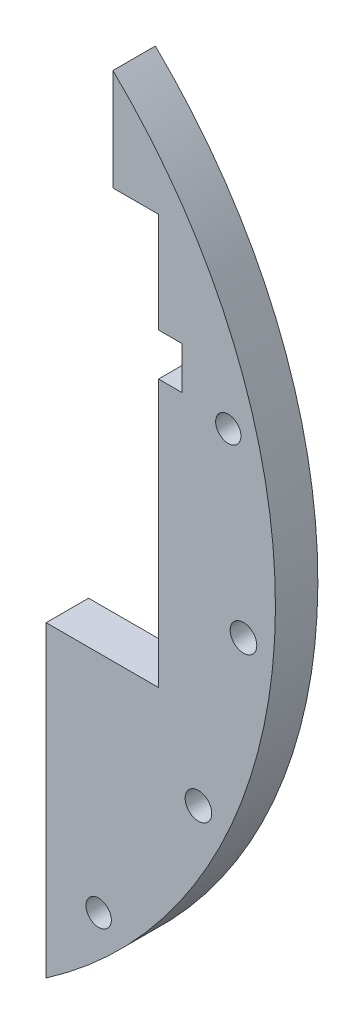
from build123d import *

# Parameters (mm, degrees)
SKETCH1_R              = 79.5
SKETCH1_R_2            = 1.9939
SKETCH1_R_3            = 1.89865
SKETCH1_R_4            = 8
BOSS_EXTRUDE1_DEPTH    = 6.35
SKETCH5_W              = 15.2
SKETCH5_H              = 16.075
CUT_EXTRUDE4_DEPTH     = 113.609158153
SKETCH6_R              = 1
CUT_EXTRUDE5_DEPTH     = 113.609158153
FILLET1_R              = 1
SKETCH10_W             = 53.523609979
SKETCH10_H             = 37.243469735
SKETCH10_W_2           = 54.285324016
SKETCH10_H_2           = 37.23416744
BOSS_EXTRUDE2_DEPTH    = 6.35
SKETCH11_W             = 15.2
SKETCH11_H             = 6.55
CUT_EXTRUDE8_DEPTH     = 113.609158153
SKETCH13_R             = 1
CUT_EXTRUDE9_DEPTH     = 113.609158153
FILLET2_R              = 1
LPATTERN3_COUNT        = 2
LPATTERN3_PITCH        = 30
FILLET2_OF_LPATTERN3_R = 1
MIRROR3_DEPTH          = 6.35
CUT_EXTRUDE11_DEPTH    = 113.609158153
SKETCH15_W             = 6.35
SKETCH15_H             = 80
CUT_EXTRUDE12_DEPTH    = 113.609158153
CUT_EXTRUDE14_DEPTH    = 113.609158153
CUT_EXTRUDE18_DEPTH    = 104.150578646


# Read off the part's stored shape, not the designer's step: Mirror3
with BuildPart() as part:
    # Sketch1 → Boss-Extrude1 (new body)
    with BuildSketch(Plane.XY):
        Circle(SKETCH1_R)
        with Locations((74.714602357, -6.536680706)):
            Circle(SKETCH1_R_2, mode=Mode.SUBTRACT)
        with Locations((72.444436972, 19.411428383)):
            Circle(SKETCH1_R_3, mode=Mode.SUBTRACT)
        Circle(SKETCH1_R_4, mode=Mode.SUBTRACT)
        with Locations((67.973084028, -31.696369631)):
            Circle(SKETCH1_R_2, mode=Mode.SUBTRACT)
        with Locations((10.606601718, -10.606601718)):
            Circle(SKETCH1_R_2, mode=Mode.SUBTRACT)
        with Locations((0, -75)):
            Circle(SKETCH1_R_3, mode=Mode.SUBTRACT)
        with Locations((-10.606601718, -10.606601718)):
            Circle(SKETCH1_R_2, mode=Mode.SUBTRACT)
        with Locations((-10.606601718, 10.606601718)):
            Circle(SKETCH1_R_2, mode=Mode.SUBTRACT)
        with Locations((10.606601718, 10.606601718)):
            Circle(SKETCH1_R_2, mode=Mode.SUBTRACT)
        with Locations((-53.033008589, -53.033008589)):
            Circle(SKETCH1_R_3, mode=Mode.SUBTRACT)
        with Locations((-75, 0)):
            Circle(SKETCH1_R_3, mode=Mode.SUBTRACT)
        with Locations((-53.033008589, 53.033008589)):
            Circle(SKETCH1_R_3, mode=Mode.SUBTRACT)
        with Locations((0, 75)):
            Circle(SKETCH1_R_3, mode=Mode.SUBTRACT)
        with Locations((53.033008589, -53.033008589)):
            Circle(SKETCH1_R_3, mode=Mode.SUBTRACT)
    extrude(amount=BOSS_EXTRUDE1_DEPTH)

    # Sketch5 → Cut-Extrude4 (cut, through all)
    with BuildSketch(Plane.XY.offset(6.35)):
        with Locations((-30, -37.9375)):
            Rectangle(SKETCH5_W, SKETCH5_H)
        with Locations((-30, 37.9375)):
            Rectangle(SKETCH5_W, SKETCH5_H)
        with Locations((30, 37.9375)):
            Rectangle(SKETCH5_W, SKETCH5_H)
        with Locations((0, -37.9375)):
            Rectangle(SKETCH5_W, SKETCH5_H)
        with Locations((30, -37.9375)):
            Rectangle(SKETCH5_W, SKETCH5_H)
        with Locations((0, 37.9375)):
            Rectangle(SKETCH5_W, SKETCH5_H)
    extrude(amount=-CUT_EXTRUDE4_DEPTH, mode=Mode.SUBTRACT)

    # Sketch6 → Cut-Extrude5 (cut, through all)
    with BuildSketch(Plane.XY.offset(6.35)):
        with Locations((-37.6, 45.975)):
            Circle(SKETCH6_R)
        with Locations((-22.4, 45.975)):
            Circle(SKETCH6_R)
        with Locations((-37.6, 29.9)):
            Circle(SKETCH6_R)
        with Locations((-22.4, 29.9)):
            Circle(SKETCH6_R)
        with Locations((-7.6, 45.975)):
            Circle(SKETCH6_R)
        with Locations((7.6, 45.975)):
            Circle(SKETCH6_R)
        with Locations((-7.6, 29.9)):
            Circle(SKETCH6_R)
        with Locations((7.6, 29.9)):
            Circle(SKETCH6_R)
        with Locations((22.4, 45.975)):
            Circle(SKETCH6_R)
        with Locations((37.6, 45.975)):
            Circle(SKETCH6_R)
        with Locations((22.4, 29.9)):
            Circle(SKETCH6_R)
        with Locations((37.6, 29.9)):
            Circle(SKETCH6_R)
        with Locations((-37.6, -29.9)):
            Circle(SKETCH6_R)
        with Locations((-22.4, -29.9)):
            Circle(SKETCH6_R)
        with Locations((-37.6, -45.975)):
            Circle(SKETCH6_R)
        with Locations((-22.4, -45.975)):
            Circle(SKETCH6_R)
        with Locations((-7.6, -29.9)):
            Circle(SKETCH6_R)
        with Locations((7.6, -29.9)):
            Circle(SKETCH6_R)
        with Locations((-7.6, -45.975)):
            Circle(SKETCH6_R)
        with Locations((7.6, -45.975)):
            Circle(SKETCH6_R)
        with Locations((22.4, -29.9)):
            Circle(SKETCH6_R)
        with Locations((37.6, -29.9)):
            Circle(SKETCH6_R)
        with Locations((22.4, -45.975)):
            Circle(SKETCH6_R)
        with Locations((37.6, -45.975)):
            Circle(SKETCH6_R)
    extrude(amount=-CUT_EXTRUDE5_DEPTH, mode=Mode.SUBTRACT)

    # Fillet1
    fillet1_edges = [part.edges().sort_by_distance(p)[0] for p in [
        (-37.6, 44.975, 3.175),
        (-36.6, 45.975, 3.175),
        (-22.4, 44.975, 3.175),
        (-23.4, 45.975, 3.175),
        (-37.6, 30.9, 3.175),
        (-36.6, 29.9, 3.175),
        (-23.4, 29.9, 3.175),
        (-22.4, 30.9, 3.175),
        (-7.6, 44.975, 3.175),
        (-6.6, 45.975, 3.175),
        (7.6, 44.975, 3.175),
        (6.6, 45.975, 3.175),
        (-7.6, 30.9, 3.175),
        (-6.6, 29.9, 3.175),
        (6.6, 29.9, 3.175),
        (7.6, 30.9, 3.175),
        (22.4, 44.975, 3.175),
        (23.4, 45.975, 3.175),
        (37.6, 44.975, 3.175),
        (36.6, 45.975, 3.175),
        (22.4, 30.9, 3.175),
        (23.4, 29.9, 3.175),
        (36.6, 29.9, 3.175),
        (37.6, 30.9, 3.175),
        (-36.6, -29.9, 3.175),
        (-37.6, -30.9, 3.175),
        (-22.4, -30.9, 3.175),
        (-23.4, -29.9, 3.175),
        (-36.6, -45.975, 3.175),
        (-37.6, -44.975, 3.175),
        (-23.4, -45.975, 3.175),
        (-22.4, -44.975, 3.175),
        (-6.6, -29.9, 3.175),
        (-7.6, -30.9, 3.175),
        (7.6, -30.9, 3.175),
        (6.6, -29.9, 3.175),
        (-6.6, -45.975, 3.175),
        (-7.6, -44.975, 3.175),
        (6.6, -45.975, 3.175),
        (7.6, -44.975, 3.175),
        (23.4, -29.9, 3.175),
        (22.4, -30.9, 3.175),
        (37.6, -30.9, 3.175),
        (36.6, -29.9, 3.175),
        (23.4, -45.975, 3.175),
        (22.4, -44.975, 3.175),
        (36.6, -45.975, 3.175),
        (37.6, -44.975, 3.175),
    ]]
    fillet(fillet1_edges, radius=FILLET1_R)

    # Sketch10 → Boss-Extrude2 (add, through all)
    with BuildSketch(Plane(origin=(0, 0, 0), x_dir=(-1, 0, 0), z_dir=(0, 0, -1))):
        with Locations((-13.786008458, 43.712822415)):
            Rectangle(SKETCH10_W, SKETCH10_H)
        with Locations((-15.177733449, -42.065637654)):
            Rectangle(SKETCH10_W_2, SKETCH10_H_2)
    extrude(amount=-BOSS_EXTRUDE2_DEPTH)

    # Sketch11 → Cut-Extrude8 (cut, through all)
    with BuildSketch(Plane(origin=(0, 0, 0), x_dir=(-1, 0, 0), z_dir=(0, 0, -1))):
        with Locations((0, 33.175)):
            Rectangle(SKETCH11_W, SKETCH11_H)
    cut_extrude8 = extrude(amount=-CUT_EXTRUDE8_DEPTH, mode=Mode.SUBTRACT)

    # Sketch13 → Cut-Extrude9 (cut, through all)
    with BuildSketch(Plane(origin=(0, 0, 0), x_dir=(-1, 0, 0), z_dir=(0, 0, -1))):
        with Locations((-7.6, 36.45)):
            Circle(SKETCH13_R)
        with Locations((-7.6, 29.9)):
            Circle(SKETCH13_R)
        with Locations((7.6, 29.9)):
            Circle(SKETCH13_R)
        with Locations((7.6, 36.45)):
            Circle(SKETCH13_R)
    cut_extrude9 = extrude(amount=-CUT_EXTRUDE9_DEPTH, mode=Mode.SUBTRACT)

    # Fillet2
    fillet2_edges = [part.edges().sort_by_distance(p)[0] for p in [
        (6.6, 36.45, 3.175),
        (7.6, 35.45, 3.175),
        (-6.6, 36.45, 3.175),
        (7.6, 30.9, 3.175),
        (-6.6, 29.9, 3.175),
        (6.6, 29.9, 3.175),
        (-7.6, 30.9, 3.175),
        (-7.6, 35.45, 3.175),
    ]]
    fillet(fillet2_edges, radius=FILLET2_R)

    # LPattern3: Cut-Extrude8, Cut-Extrude9 ×2
    with Locations(*[(i * LPATTERN3_PITCH, 0, 0) for i in range(1, LPATTERN3_COUNT)]):
        add(cut_extrude8, mode=Mode.SUBTRACT)
        add(cut_extrude9, mode=Mode.SUBTRACT)

    # Fillet2 of LPattern3
    fillet2_of_lpattern3_edges = [part.edges().sort_by_distance(p)[0] for p in [
        (36.6, 36.45, 3.175),
        (37.6, 35.45, 3.175),
        (23.4, 36.45, 3.175),
        (37.6, 30.9, 3.175),
        (23.4, 29.9, 3.175),
        (36.6, 29.9, 3.175),
        (22.4, 30.9, 3.175),
        (22.4, 35.45, 3.175),
    ]]
    fillet(fillet2_of_lpattern3_edges, radius=FILLET2_OF_LPATTERN3_R)

    # Mirror3 outline → Mirror3 (cut)
    with BuildSketch(Plane.XY):
        with BuildLine():
            Line((-5.867949192, -36.45), (5.867949192, -36.45))
            ThreePointArc((5.867949192, -36.45), (6.367949192, -36.583974596), (6.733974596, -36.95))
            ThreePointArc((6.733974596, -36.95), (8.307106781, -37.157106781), (8.1, -35.583974596))
            ThreePointArc((8.1, -35.583974596), (7.733974596, -35.217949192), (7.6, -34.717949192))
            Line((7.6, -34.717949192), (7.6, -31.632050808))
            ThreePointArc((7.6, -31.632050808), (7.733974596, -31.132050808), (8.1, -30.766025404))
            ThreePointArc((8.1, -30.766025404), (8.307106781, -29.192893219), (6.733974596, -29.4))
            ThreePointArc((6.733974596, -29.4), (6.367949192, -29.766025404), (5.867949192, -29.9))
            Line((5.867949192, -29.9), (-5.867949192, -29.9))
            ThreePointArc((-5.867949192, -29.9), (-6.367949192, -29.766025404), (-6.733974596, -29.4))
            ThreePointArc((-6.733974596, -29.4), (-8.307106781, -29.192893219), (-8.1, -30.766025404))
            ThreePointArc((-8.1, -30.766025404), (-7.733974596, -31.132050808), (-7.6, -31.632050808))
            Line((-7.6, -31.632050808), (-7.6, -34.717949192))
            ThreePointArc((-7.6, -34.717949192), (-7.733974596, -35.217949192), (-8.1, -35.583974596))
            ThreePointArc((-8.1, -35.583974596), (-8.307106781, -37.157106781), (-6.733974596, -36.95))
            ThreePointArc((-6.733974596, -36.95), (-6.367949192, -36.583974596), (-5.867949192, -36.45))
        make_face()
        with BuildLine():
            Line((24.132050808, -36.45), (35.867949192, -36.45))
            ThreePointArc((35.867949192, -36.45), (36.367949192, -36.583974596), (36.733974596, -36.95))
            ThreePointArc((36.733974596, -36.95), (38.307106781, -37.157106781), (38.1, -35.583974596))
            ThreePointArc((38.1, -35.583974596), (37.733974596, -35.217949192), (37.6, -34.717949192))
            Line((37.6, -34.717949192), (37.6, -31.632050808))
            ThreePointArc((37.6, -31.632050808), (37.733974596, -31.132050808), (38.1, -30.766025404))
            ThreePointArc((38.1, -30.766025404), (38.307106781, -29.192893219), (36.733974596, -29.4))
            ThreePointArc((36.733974596, -29.4), (36.367949192, -29.766025404), (35.867949192, -29.9))
            Line((35.867949192, -29.9), (24.132050808, -29.9))
            ThreePointArc((24.132050808, -29.9), (23.632050808, -29.766025404), (23.266025404, -29.4))
            ThreePointArc((23.266025404, -29.4), (21.692893219, -29.192893219), (21.9, -30.766025404))
            ThreePointArc((21.9, -30.766025404), (22.266025404, -31.132050808), (22.4, -31.632050808))
            Line((22.4, -31.632050808), (22.4, -34.717949192))
            ThreePointArc((22.4, -34.717949192), (22.266025404, -35.217949192), (21.9, -35.583974596))
            ThreePointArc((21.9, -35.583974596), (21.692893219, -37.157106781), (23.266025404, -36.95))
            ThreePointArc((23.266025404, -36.95), (23.632050808, -36.583974596), (24.132050808, -36.45))
        make_face()
    extrude(amount=MIRROR3_DEPTH, mode=Mode.SUBTRACT)

    # Sketch14 → Cut-Extrude11 (cut, through all)
    with BuildSketch(Plane.XY):
        Polygon((33.5, -19.35), (62, -19.35), (62, 20.65), (65.5, 20.65), (65.5, 27), (62, 27), (62, 42), (42, 42), (42, 27), (38.5, 27), (38.5, 20.65), (42, 20.65), (42, 15.65), (33.5, 15.65), align=None)
    extrude(amount=CUT_EXTRUDE11_DEPTH, mode=Mode.SUBTRACT)

    # Sketch15 → Cut-Extrude12 (cut, through all)
    with BuildSketch(Plane.XY.offset(6.35)):
        with Locations((52, 42)):
            Rectangle(SKETCH15_W, SKETCH15_H)
    extrude(amount=-CUT_EXTRUDE12_DEPTH, mode=Mode.SUBTRACT)

    # Sketch16 → Cut-Extrude14 (cut, through all)
    with BuildSketch(Plane.XY):
        with BuildLine():
            Line((42, -37.5), (42, -14.02059918))
            Line((42, -14.02059918), (45.175, -14.029540215))
            Line((45.175, -14.029540215), (45.175, -79.5))
            Line((45.175, -79.5), (0, -79.5))
            ThreePointArc((0, -79.5), (29.69848481, -67.19848481), (42, -37.5))
        make_face()
        with BuildLine():
            Line((0, 79.5), (45.175, 79.5))
            Line((45.175, 79.5), (45.175, 14.029540215))
            Line((45.175, 14.029540215), (42, 14.02059918))
            Line((42, 14.02059918), (42, 37.5))
            ThreePointArc((42, 37.5), (29.69848481, 67.19848481), (0, 79.5))
        make_face()
    extrude(amount=CUT_EXTRUDE14_DEPTH, mode=Mode.SUBTRACT)


with BuildPart() as cut_extrude14_piece_1:
    # of the separate pieces the step leaves, piece 1, a body of its own (cut_extrude14_pieces_kept)
    add(part.part.solids().sort_by_distance((45.175, -65.41765339, 6.35))[0])


with BuildPart() as cut_extrude14_piece_2:
    # of the separate pieces the step leaves, piece 2, a body of its own (cut_extrude14_pieces_kept)
    add(part.part.solids().sort_by_distance((48.825, 62.740492308, 6.35))[0])

    # Sketch24 → Cut-Extrude18 (cut, through all)
    with BuildSketch(Plane.XY.offset(6.35)):
        with BuildLine():
            Line((45.175, 65.41765339), (45.175, 42))
            Line((45.175, 42), (48.825, 42))
            Line((48.825, 42), (48.825, 62.740492308))
            ThreePointArc((48.825, 62.740492308), (47.019057816, 64.10505598), (45.175, 65.41765339))
        make_face()
    extrude(amount=-CUT_EXTRUDE18_DEPTH, mode=Mode.SUBTRACT)


solid = cut_extrude14_piece_1.part
